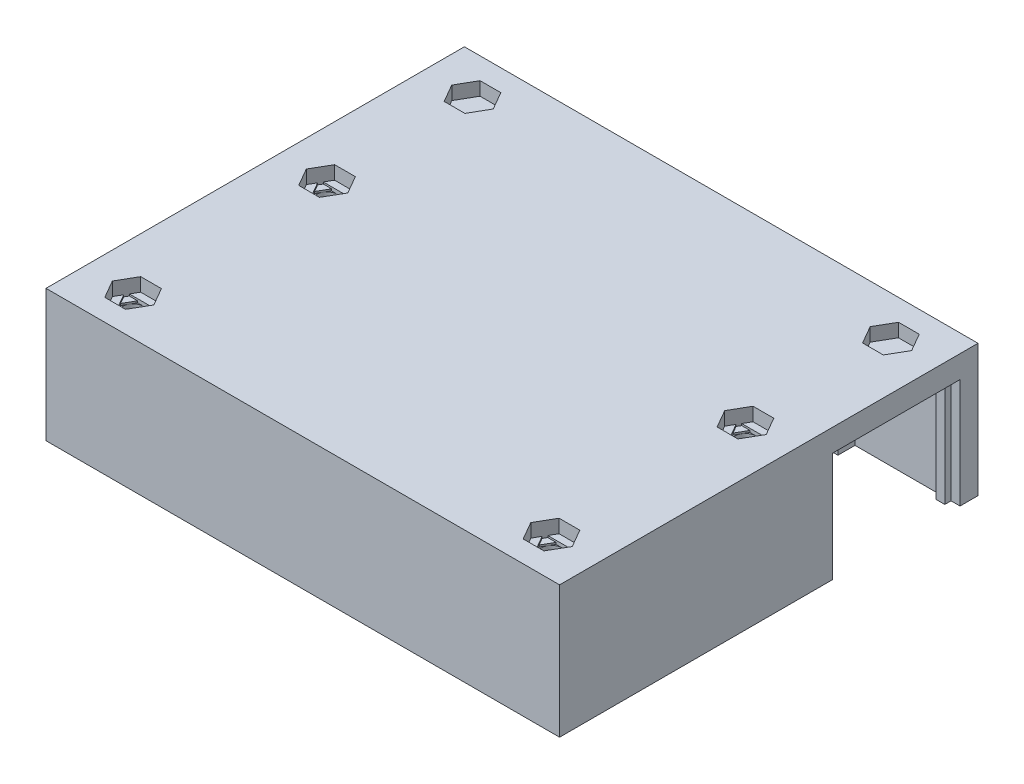
from build123d import *

# Parameters (mm, degrees)
SKETCH1_W           = 57.2
SKETCH1_H           = 46.6
SKETCH1_R           = 1.2
BOSS_EXTRUDE1_DEPTH = 2
BOSS_EXTRUDE2_DEPTH = 12.2
SKETCH1_6_W         = 3.9
SKETCH1_6_H         = 10.4
BOSS_EXTRUDE3_DEPTH = 1.8
CUT_EXTRUDE1_DEPTH  = 100
BOSS_EXTRUDE4_DEPTH = 12.2
SKETCH1_10_W        = 2
SKETCH1_10_H        = 2
BOSS_EXTRUDE5_DEPTH = 2
SKETCH4_W           = 57.2
SKETCH4_H           = 46.6
BOSS_EXTRUDE6_DEPTH = 0.5
CUT_EXTRUDE2_DEPTH  = 1
CUT_EXTRUDE4_START  = -0.2
CUT_EXTRUDE4_DEPTH  = 0.2
CUT_EXTRUDE5_START  = -0.4
CUT_EXTRUDE5_DEPTH  = 0.4


with BuildPart() as part:
    # Sketch1 → Boss-Extrude1 (new body)
    with BuildSketch(Plane(origin=(0, 0, 0), x_dir=(1, 0, 0), z_dir=(0, 1, 0))):
        with Locations((21.75, -14.2)):
            Rectangle(SKETCH1_W, SKETCH1_H)
        with Locations((45.05, -11.5)):
            Circle(SKETCH1_R, mode=Mode.SUBTRACT)
        with Locations((-1.55, -11.5)):
            Circle(SKETCH1_R, mode=Mode.SUBTRACT)
        with Locations((-1.55, -33.1)):
            Circle(SKETCH1_R, mode=Mode.SUBTRACT)
        with Locations((45.05, -33.1)):
            Circle(SKETCH1_R, mode=Mode.SUBTRACT)
    extrude(amount=BOSS_EXTRUDE1_DEPTH)

    # Sketch1<5> → Boss-Extrude2 (add)
    with BuildSketch(Plane(origin=(0, 0, 0), x_dir=(1, 0, 0), z_dir=(0, 1, 0))):
        Polygon((-4.85, 6.4), (-4.85, 7.1), (4.85, 7.1), (4.85, 5.2), (8.75, 5.2), (8.75, -5.2), (4.85, -5.2), (4.85, -7.1), (-4.85, -7.1), (-4.85, -6.4), (-5.85, -6.4), (-5.85, -7.1), (-6.85, -7.1), (-6.85, -9.1), (6.85, -9.1), (6.85, -7.2), (10.75, -7.2), (10.75, 7.2), (6.85, 7.2), (6.85, 9.1), (-6.85, 9.1), (-6.85, 7.1), (-5.85, 7.1), (-5.85, 6.4), align=None)
        Polygon((36.65, 9.1), (36.65, 7.2), (32.75, 7.2), (32.75, -7.2), (36.65, -7.2), (36.65, -9.1), (50.35, -9.1), (50.35, -7.1), (49.35, -7.1), (49.35, -6.4), (48.35, -6.4), (48.35, -7.1), (38.65, -7.1), (38.65, -5.2), (34.75, -5.2), (34.75, 5.2), (38.65, 5.2), (38.65, 7.1), (48.35, 7.1), (48.35, 6.4), (49.35, 6.4), (49.35, 7.1), (50.35, 7.1), (50.35, 9.1), align=None)
    extrude(amount=-BOSS_EXTRUDE2_DEPTH)

    # Sketch1<6> → Boss-Extrude3 (add)
    with BuildSketch(Plane(origin=(0, 0, 0), x_dir=(1, 0, 0), z_dir=(0, 1, 0))):
        with Locations((6.8, 0)):
            Rectangle(SKETCH1_6_W, SKETCH1_6_H)
        with Locations((36.7, 0)):
            Rectangle(SKETCH1_6_W, SKETCH1_6_H)
    extrude(amount=-BOSS_EXTRUDE3_DEPTH)

    # Sketch3 → Cut-Extrude1 (cut)
    with BuildSketch(Plane.ZY.offset(-8.75)):
        Polygon((-2.299018758, -2.2), (-3.996075033, -3.897056275), (-2.299018758, -5.59411255), (-0.601962483, -3.897056275), align=None)
        Polygon((2.299018758, -2.2), (0.601962483, -3.897056275), (2.299018758, -5.59411255), (3.996075033, -3.897056275), align=None)
    extrude(amount=-CUT_EXTRUDE1_DEPTH, mode=Mode.SUBTRACT)

    # Sketch1<9> → Boss-Extrude4 (add)
    with BuildSketch(Plane(origin=(0, 0, 0), x_dir=(1, 0, 0), z_dir=(0, 1, 0))):
        Polygon((-5.85, -9.1), (-6.85, -9.1), (-6.85, -37.5), (50.35, -37.5), (50.35, -9.1), (49.35, -9.1), (48.35, -9.1), (48.35, -35.5), (-4.85, -35.5), (-4.85, -9.1), align=None)
    extrude(amount=-BOSS_EXTRUDE4_DEPTH)

    # Sketch1<10> → Boss-Extrude5 (add)
    with BuildSketch(Plane(origin=(0, 0, 0), x_dir=(1, 0, 0), z_dir=(0, 1, 0))):
        with Locations((-1.55, -14.7)):
            Rectangle(SKETCH1_10_W, SKETCH1_10_H)
        with Locations((45.05, -14.7)):
            Rectangle(SKETCH1_10_W, SKETCH1_10_H)
        with Locations((-1.55, -29.9)):
            Rectangle(SKETCH1_10_W, SKETCH1_10_H)
        with Locations((45.05, -29.9)):
            Rectangle(SKETCH1_10_W, SKETCH1_10_H)
    extrude(amount=-BOSS_EXTRUDE5_DEPTH)

    # Sketch4 → Boss-Extrude6 (add)
    with BuildSketch(Plane(origin=(0, 2, 0), x_dir=(1, 0, 0), z_dir=(0, 1, 0))):
        with Locations((21.75, -14.2)):
            Rectangle(SKETCH4_W, SKETCH4_H)
        Polygon((-2.704700538, -9.5), (-0.395299462, -9.5), (0.759401077, -11.5), (-0.395299462, -13.5), (-2.704700538, -13.5), (-3.859401077, -11.5), align=None, mode=Mode.SUBTRACT)
        Polygon((-2.704700538, -31.1), (-0.395299462, -31.1), (0.759401077, -33.1), (-0.395299462, -35.1), (-2.704700538, -35.1), (-3.859401077, -33.1), align=None, mode=Mode.SUBTRACT)
        Polygon((43.895299462, -31.1), (46.204700538, -31.1), (47.359401077, -33.1), (46.204700538, -35.1), (43.895299462, -35.1), (42.740598923, -33.1), align=None, mode=Mode.SUBTRACT)
        Polygon((43.895299462, 6.7), (46.204700538, 6.7), (47.359401077, 4.7), (46.204700538, 2.7), (43.895299462, 2.7), (42.740598923, 4.7), align=None, mode=Mode.SUBTRACT)
        Polygon((-2.704700538, 6.7), (-0.395299462, 6.7), (0.759401077, 4.7), (-0.395299462, 2.7), (-2.704700538, 2.7), (-3.859401077, 4.7), align=None, mode=Mode.SUBTRACT)
        Polygon((43.895299462, -9.5), (46.204700538, -9.5), (47.359401077, -11.5), (46.204700538, -13.5), (43.895299462, -13.5), (42.740598923, -11.5), align=None, mode=Mode.SUBTRACT)
    extrude(amount=BOSS_EXTRUDE6_DEPTH)

    # Sketch4<3> → Cut-Extrude2 (cut)
    with BuildSketch(Plane(origin=(0, 2, 0), x_dir=(1, 0, 0), z_dir=(0, 1, 0))):
        Polygon((0.759401077, -33.1), (-0.395299462, -31.1), (-2.704700538, -31.1), (-3.859401077, -33.1), (-2.704700538, -35.1), (-0.395299462, -35.1), align=None)
        Polygon((0.759401077, -11.5), (-0.395299462, -9.5), (-2.704700538, -9.5), (-3.859401077, -11.5), (-2.704700538, -13.5), (-0.395299462, -13.5), align=None)
        Polygon((47.359401077, -11.5), (46.204700538, -9.5), (43.895299462, -9.5), (42.740598923, -11.5), (43.895299462, -13.5), (46.204700538, -13.5), align=None)
        Polygon((47.359401077, -33.1), (46.204700538, -31.1), (43.895299462, -31.1), (42.740598923, -33.1), (43.895299462, -35.1), (46.204700538, -35.1), align=None)
        Polygon((0.759401077, 4.7), (-0.395299462, 6.7), (-2.704700538, 6.7), (-3.859401077, 4.7), (-2.704700538, 2.7), (-0.395299462, 2.7), align=None)
        Polygon((47.359401077, 4.7), (46.204700538, 6.7), (43.895299462, 6.7), (42.740598923, 4.7), (43.895299462, 2.7), (46.204700538, 2.7), align=None)
    extrude(amount=-CUT_EXTRUDE2_DEPTH, mode=Mode.SUBTRACT)

    # Sketch5<5> → Cut-Extrude4 (cut)
    with BuildSketch(Plane(origin=(0, 1, 0), x_dir=(1, 0, 0), z_dir=(0, 1, 0)).offset(CUT_EXTRUDE4_START)):
        with BuildLine():
            Line((-1.55, -10.3), (-3.166580754, -10.3))
            Line((-3.166580754, -10.3), (-3.397520861, -10.7))
            Line((-3.397520861, -10.7), (-2.589230496, -12.09999998))
            ThreePointArc((-2.589230496, -12.09999998), (-2.589230479, -10.89999999), (-1.55, -10.3))
        make_face()
        with BuildLine():
            Line((0.066580754, -10.3), (-1.55, -10.3))
            ThreePointArc((-1.55, -10.3), (-0.510769508, -10.900000013), (-0.510769531, -12.100000026))
            Line((-0.510769531, -12.100000026), (0.297520861, -10.7))
            Line((0.297520861, -10.7), (0.066580754, -10.3))
        make_face()
        with BuildLine():
            Line((-2.589230496, -12.09999998), (-1.780940108, -13.5))
            Line((-1.780940108, -13.5), (-1.319059892, -13.5))
            Line((-1.319059892, -13.5), (-0.510769531, -12.100000026))
            ThreePointArc((-0.510769531, -12.100000026), (-1.550000027, -12.7), (-2.589230496, -12.09999998))
        make_face()
        Polygon((44.819059892, -35.1), (45.280940108, -35.1), (46.897520861, -32.3), (46.666580754, -31.9), (43.433419246, -31.9), (43.202479139, -32.3), align=None)
        Polygon((43.433419246, -10.3), (43.202479139, -10.7), (44.819059892, -13.5), (45.280940108, -13.5), (46.897520861, -10.7), (46.666580754, -10.3), align=None)
        Polygon((0.297520861, -32.3), (0.066580754, -31.9), (-3.166580754, -31.9), (-3.397520861, -32.3), (-1.780940108, -35.1), (-1.319059892, -35.1), align=None)
    extrude(amount=CUT_EXTRUDE4_DEPTH, mode=Mode.SUBTRACT)

    # Sketch5 → Cut-Extrude5 (cut)
    with BuildSketch(Plane(origin=(0, 1, 0), x_dir=(1, 0, 0), z_dir=(0, 1, 0)).offset(CUT_EXTRUDE5_START)):
        with BuildLine():
            Line((-1.55, -10.3), (-2.242820323, -10.3))
            Line((-2.242820323, -10.3), (-2.589230527, -10.900000074))
            ThreePointArc((-2.589230527, -10.900000074), (-2.150000037, -10.460769537), (-1.55, -10.3))
        make_face()
        with BuildLine():
            Line((-0.510769478, -10.900000064), (-0.857179677, -10.3))
            Line((-0.857179677, -10.3), (-1.55, -10.3))
            ThreePointArc((-1.55, -10.3), (-0.949999968, -10.460769534), (-0.510769478, -10.900000064))
        make_face()
        with BuildLine():
            ThreePointArc((-2.589230496, -12.09999998), (-2.75, -11.500000031), (-2.589230527, -10.900000074))
            Line((-2.589230527, -10.900000074), (-2.935640646, -11.5))
            Line((-2.935640646, -11.5), (-2.589230496, -12.09999998))
        make_face()
        with BuildLine():
            Line((-0.164359354, -11.5), (-0.510769478, -10.900000064))
            ThreePointArc((-0.510769478, -10.900000064), (-0.35, -11.500000052), (-0.510769531, -12.100000026))
            Line((-0.510769531, -12.100000026), (-0.164359354, -11.5))
        make_face()
        with BuildLine():
            ThreePointArc((-1.550000015, -12.7), (-2.150000016, -12.539230475), (-2.589230496, -12.09999998))
            Line((-2.589230496, -12.09999998), (-2.242820323, -12.7))
            Line((-2.242820323, -12.7), (-1.550000015, -12.7))
        make_face()
        with BuildLine():
            ThreePointArc((-0.510769531, -12.100000026), (-0.95000002, -12.539230496), (-1.550000015, -12.7))
            Line((-1.550000015, -12.7), (-0.857179677, -12.7))
            Line((-0.857179677, -12.7), (-0.510769531, -12.100000026))
        make_face()
        Polygon((44.357179677, -34.3), (45.742820323, -34.3), (46.435640646, -33.1), (45.742820323, -31.9), (44.357179677, -31.9), (43.664359354, -33.1), align=None)
        Polygon((44.357179677, -10.3), (43.664359354, -11.5), (44.357179677, -12.7), (45.742820323, -12.7), (46.435640646, -11.5), (45.742820323, -10.3), align=None)
        Polygon((-0.857179677, -34.3), (-0.164359354, -33.1), (-0.857179677, -31.9), (-2.242820323, -31.9), (-2.935640646, -33.1), (-2.242820323, -34.3), align=None)
    extrude(amount=CUT_EXTRUDE5_DEPTH, mode=Mode.SUBTRACT)


solid = part.part
